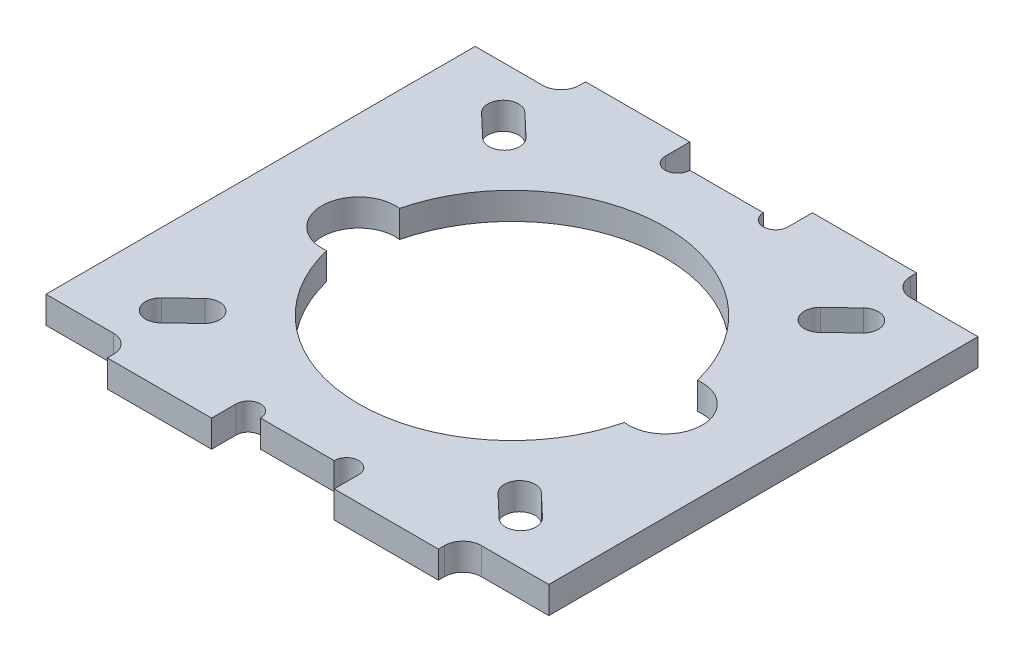
from build123d import *

# Parameters (mm, degrees)
SKETCH1_W            = 41
SKETCH1_H            = 39
BOSS_EXTRUDE1_DEPTH  = 2.2
SKETCH2_R            = 12.5
CUT_EXTRUDE1_DEPTH   = 29.378512998
SKETCH3_R            = 3
CUT_EXTRUDE2_DEPTH   = 29.378512998
SKETCH4_W            = 7
SKETCH4_H            = 2
CUT_EXTRUDE3_DEPTH   = 29.378512998
FILLET1_R            = 1.5
FILLET1_OF_MIRROR1_R = 1.5
MIRROR3_DEPTH        = 2.2


# Read off the part's stored shape, not the designer's step: Mirror3
with BuildPart() as part:
    # Sketch1 → Boss-Extrude1 (new body)
    with BuildSketch(Plane(origin=(0, 0, 0), x_dir=(1, 0, 0), z_dir=(0, 1, 0))):
        Rectangle(SKETCH1_W, SKETCH1_H)
    extrude(amount=BOSS_EXTRUDE1_DEPTH)

    # Sketch2 → Cut-Extrude1 (cut, through all)
    with BuildSketch(Plane(origin=(0, 0, 0), x_dir=(1, 0, 0), z_dir=(0, 1, 0))):
        with Locations(Location((0, 0, 0), (0, 0, 270))):
            Circle(SKETCH2_R)
    extrude(amount=CUT_EXTRUDE1_DEPTH, mode=Mode.SUBTRACT)

    # Sketch3 → Cut-Extrude2 (cut, through all)
    with BuildSketch(Plane(origin=(0, 0, 0), x_dir=(1, 0, 0), z_dir=(0, 1, 0))):
        with Locations((12.5, 0)):
            Circle(SKETCH3_R)
        with Locations((-12.5, 0)):
            Circle(SKETCH3_R)
        with BuildLine():
            Line((11.999388387, 13.139241924), (13.810783542, 14.862276339))
            ThreePointArc((13.810783542, 14.862276339), (15.577998326, 14.818095969), (15.533817957, 13.050881184))
            Line((15.533817957, 13.050881184), (13.722422802, 11.327846769))
            ThreePointArc((13.722422802, 11.327846769), (11.955208018, 11.372027139), (11.999388387, 13.139241924))
        make_face()
        with BuildLine():
            Line((11.999388387, -13.139241924), (13.810783542, -14.862276339))
            ThreePointArc((13.810783542, -14.862276339), (15.577998326, -14.818095969), (15.533817957, -13.050881184))
            Line((15.533817957, -13.050881184), (13.722422802, -11.327846769))
            ThreePointArc((13.722422802, -11.327846769), (11.955208018, -11.372027139), (11.999388387, -13.139241924))
        make_face()
        with BuildLine():
            Line((-11.999388387, -13.139241924), (-13.810783542, -14.862276339))
            ThreePointArc((-13.810783542, -14.862276339), (-15.577998326, -14.818095969), (-15.533817957, -13.050881184))
            Line((-15.533817957, -13.050881184), (-13.722422802, -11.327846769))
            ThreePointArc((-13.722422802, -11.327846769), (-11.955208018, -11.372027139), (-11.999388387, -13.139241924))
        make_face()
        with BuildLine():
            Line((-11.999388387, 13.139241924), (-13.810783542, 14.862276339))
            ThreePointArc((-13.810783542, 14.862276339), (-15.577998326, 14.818095969), (-15.533817957, 13.050881184))
            Line((-15.533817957, 13.050881184), (-13.722422802, 11.327846769))
            ThreePointArc((-13.722422802, 11.327846769), (-11.955208018, 11.372027139), (-11.999388387, 13.139241924))
        make_face()
    extrude(amount=CUT_EXTRUDE2_DEPTH, mode=Mode.SUBTRACT)

    # Sketch4 → Cut-Extrude3 (cut, through all)
    with BuildSketch(Plane(origin=(0, 0, 0), x_dir=(1, 0, 0), z_dir=(0, 1, 0))):
        with Locations((17, 18.5)):
            Rectangle(SKETCH4_W, SKETCH4_H)
        with BuildLine():
            Line((0, 19.5), (5, 19.5))
            Line((5, 19.5), (5, 17.5))
            ThreePointArc((5, 17.5), (4, 16.5), (3, 17.5))
            Line((3, 17.5), (0, 17.5))
            Line((0, 17.5), (0, 19.5))
        make_face()
    cut_extrude3 = extrude(amount=CUT_EXTRUDE3_DEPTH, mode=Mode.SUBTRACT)

    # Fillet1
    fillet1_edges = [part.edges().sort_by_distance(p)[0] for p in [
        (13.5, 1.1, -17.5),
    ]]
    fillet(fillet1_edges, radius=FILLET1_R)

    # Mirror1: Cut-Extrude3 across plane
    add(cut_extrude3.mirror(Plane(origin=(0, 0, 0), x_dir=(0, 0, 1), z_dir=(1, 0, 0))), mode=Mode.SUBTRACT)

    # Fillet1 of Mirror1
    fillet1_of_mirror1_edges = [part.edges().sort_by_distance(p)[0] for p in [
        (-13.5, 1.1, -17.5),
    ]]
    fillet(fillet1_of_mirror1_edges, radius=FILLET1_OF_MIRROR1_R)

    # Mirror3 outline → Mirror3 (cut)
    with BuildSketch(Plane(origin=(0, 0, 0), x_dir=(1, 0, 0), z_dir=(0, 1, 0))):
        with BuildLine():
            Line((-5, -19.5), (5, -19.5))
            Line((5, -19.5), (5, -17.5))
            ThreePointArc((5, -17.5), (4, -16.5), (3, -17.5))
            Line((3, -17.5), (-3, -17.5))
            ThreePointArc((-3, -17.5), (-4, -16.5), (-5, -17.5))
            Line((-5, -17.5), (-5, -19.5))
        make_face()
        with BuildLine():
            Line((13.5, -19), (13.5, -19.5))
            Line((13.5, -19.5), (20.5, -19.5))
            Line((20.5, -19.5), (20.5, -17.5))
            Line((20.5, -17.5), (15, -17.5))
            ThreePointArc((15, -17.5), (13.939339828, -17.939339828), (13.5, -19))
        make_face()
        with BuildLine():
            Line((-20.5, -19.5), (-13.5, -19.5))
            Line((-13.5, -19.5), (-13.5, -19))
            ThreePointArc((-13.5, -19), (-13.939339828, -17.939339828), (-15, -17.5))
            Line((-15, -17.5), (-20.5, -17.5))
            Line((-20.5, -17.5), (-20.5, -19.5))
        make_face()
    extrude(amount=MIRROR3_DEPTH, mode=Mode.SUBTRACT)


solid = part.part
